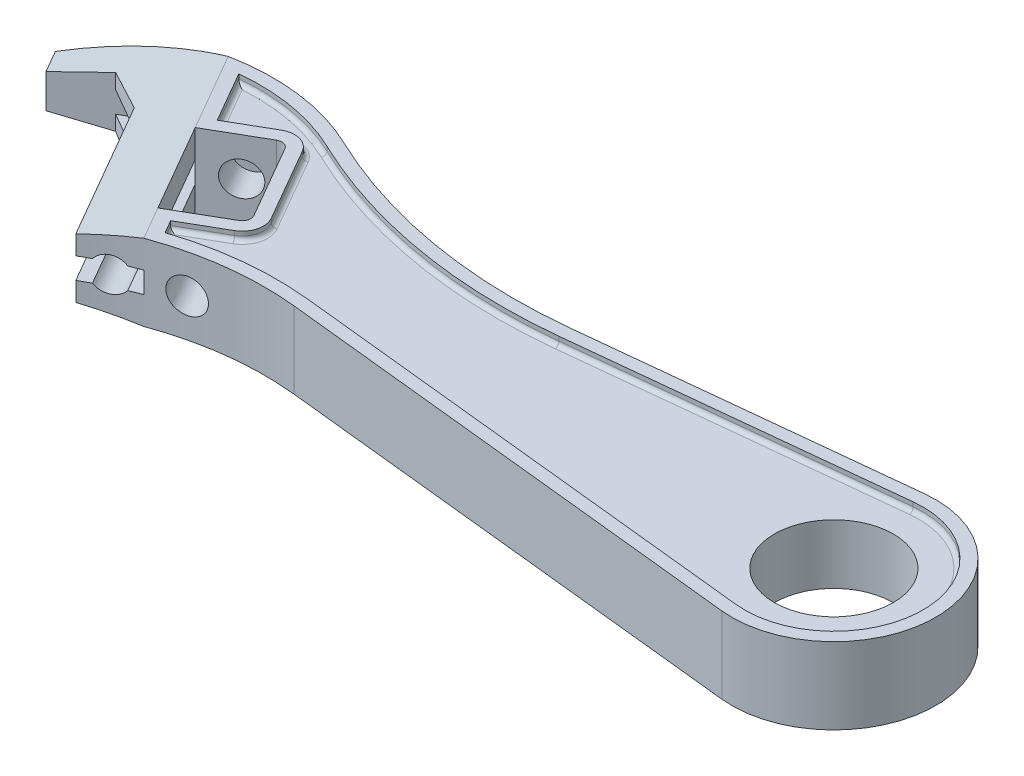
from build123d import *

# Parameters (mm, degrees)
SKETCH2_R               = 7
BOSS_EXTRUDE1_DEPTH     = 4.5
CUT_EXTRUDE1_START      = -8
CUT_EXTRUDE1_DEPTH      = 24.518120701
CUT_EXTRUDE4_DEPTH      = 93.949210641
CUT_EXTRUDE4_DEPTH_BACK = 4
SKETCH3_5_R             = 2
CUT_EXTRUDE2_DEPTH      = 93.949210641
CUT_EXTRUDE2_DEPTH_BACK = 93.949210641
CUT_EXTRUDE3_DEPTH      = 1
FILLET1_R               = 0.5
FILLET1_OF_MIRROR1_R    = 0.5


# Read off the part's stored shape, not the designer's step: Cut-Extrude1
with BuildPart() as part:
    # Sketch2 → Boss-Extrude1 (new, symmetric)
    with BuildSketch(Plane(origin=(0, 0, 0), x_dir=(1, 0, 0), z_dir=(0, 1, 0))):
        with BuildLine():
            Line((-38.985522111, 7.968555867), (-1.254341559, 11.934262744))
            ThreePointArc((-1.254341559, 11.934262744), (12, 0), (-1.254341559, -11.934262744))
            Line((-1.254341559, -11.934262744), (-57.547275152, -6.017637008))
            ThreePointArc((-57.547275152, -6.017637008), (-68.482680545, -6.590737321), (-78.705771366, -10.515014214))
            Line((-78.705771366, -10.515014214), (-88.107695155, 5.769595477))
            Line((-88.107695155, 5.769595477), (-93.303847577, 8.769595477))
            Line((-93.303847577, 8.769595477), (-98.5, 5.769595477))
            Line((-98.5, 5.769595477), (-100, 8.367671688))
            ThreePointArc((-100, 8.367671688), (-86.438642867, 15.605996242), (-71.205780018, 13.541138114))
            ThreePointArc((-71.205780018, 13.541138114), (-55.482588048, 8.517606008), (-38.985522111, 7.968555867))
        make_face()
        with Locations(Location((0, 0, 0), (0, 0, 270))):
            Circle(SKETCH2_R, mode=Mode.SUBTRACT)
        with BuildLine():
            Line((-81.509618943, 6.341392247), (-75.509618943, -4.050912599))
            Line((-75.509618943, -4.050912599), (-69.447441117, -0.550912599))
            ThreePointArc((-69.447441117, -0.550912599), (-68.98151529, 0.05629376), (-69.081415713, 0.815112805))
            Line((-69.081415713, 0.815112805), (-74.081415713, 9.475366843))
            ThreePointArc((-74.081415713, 9.475366843), (-74.688622072, 9.941292669), (-75.447441117, 9.841392247))
            Line((-75.447441117, 9.841392247), (-81.509618943, 6.341392247))
        make_face(mode=Mode.SUBTRACT)
    extrude(amount=BOSS_EXTRUDE1_DEPTH, both=True)

    # Cut-Extrude1 outline → Cut-Extrude1 (cut)
    with BuildSketch(Plane(origin=(-23.123308126, 0, -40.050744514), x_dir=(0.8660254037844396, 0, -0.49999999999999833), z_dir=(0.49999999999999833, 0, 0.8660254037844396)).offset(CUT_EXTRUDE1_START)):
        with BuildLine():
            Line((-82.418704534, 1.25), (-82.418704534, -1.25))
            Line((-82.418704534, -1.25), (-71.979954034, -1.25))
            ThreePointArc((-71.979954034, -1.25), (-70.418704534, -2), (-68.857455035, -1.25))
            Line((-68.857455035, -1.25), (-67.418704534, -1.25))
            Line((-67.418704534, -1.25), (-67.418704534, 1.25))
            Line((-67.418704534, 1.25), (-68.857455035, 1.25))
            ThreePointArc((-68.857455035, 1.25), (-70.418704534, 2), (-71.979954034, 1.25))
            Line((-71.979954034, 1.25), (-82.418704534, 1.25))
        make_face()
    extrude(amount=CUT_EXTRUDE1_DEPTH, mode=Mode.SUBTRACT)

    # Sketch3<5> → Cut-Extrude4 (cut, two sides: drawn at the far end of the back side and taken through both)
    with BuildSketch(Plane(origin=(-23.123308126, 0, -40.050744514), x_dir=(0.8660254037844396, 0, -0.49999999999999833), z_dir=(0.49999999999999833, 0, 0.8660254037844396)).offset(-CUT_EXTRUDE4_DEPTH_BACK)):
        with Locations((-63.418704534, 0)):
            Circle(SKETCH3_5_R)
    extrude(amount=CUT_EXTRUDE4_DEPTH + CUT_EXTRUDE4_DEPTH_BACK, mode=Mode.SUBTRACT)

    # Sketch3<3> → Cut-Extrude2 (cut, two sides: drawn at the far end of the back side and taken through both)
    with BuildSketch(Plane(origin=(-23.123308126, 0, -40.050744514), x_dir=(0.8660254037844396, 0, -0.49999999999999833), z_dir=(0.49999999999999833, 0, 0.8660254037844396)).offset(-CUT_EXTRUDE2_DEPTH_BACK)):
        Polygon((-67.418704534, 4.5), (-82.418704534, 4.5), (-82.418704534, 2), align=None)
        Polygon((-82.418704534, -4.5), (-82.418704534, -2), (-67.418704534, -4.5), align=None)
    extrude(amount=CUT_EXTRUDE2_DEPTH + CUT_EXTRUDE2_DEPTH_BACK, mode=Mode.SUBTRACT)

    # Sketch4 → Cut-Extrude3 (cut)
    with BuildSketch(Plane(origin=(0, 4.5, 0), x_dir=(1, 0, 0), z_dir=(0, 1, 0))):
        with BuildLine():
            Line((-84.417038698, 14.377190981), (-80.960580838, 8.390430352))
            Line((-80.960580838, 8.390430352), (-76.197441117, 11.140430352))
            ThreePointArc((-76.197441117, 11.140430352), (-74.300393504, 11.390181409), (-72.782377607, 10.225366843))
            Line((-72.782377607, 10.225366843), (-67.782377607, 1.565112805))
            ThreePointArc((-67.782377607, 1.565112805), (-67.532626551, -0.331934808), (-68.697441117, -1.849950704))
            Line((-68.697441117, -1.849950704), (-73.460580838, -4.599950704))
            Line((-73.460580838, -4.599950704), (-72.571151937, -6.14048675))
            ThreePointArc((-72.571151937, -6.14048675), (-65.066176866, -4.530624461), (-57.390482457, -4.525854165))
            Line((-57.390482457, -4.525854165), (-1.097548864, -10.442479901))
            ThreePointArc((-1.097548864, -10.442479901), (10.5, 0), (-1.097548864, 10.442479901))
            Line((-1.097548864, 10.442479901), (-38.828729416, 6.476773024))
            ThreePointArc((-38.828729416, 6.476773024), (-55.738222001, 7.039549419), (-71.854493771, 12.188669828))
            ThreePointArc((-71.854493771, 12.188669828), (-77.984484997, 14.151314674), (-84.417038698, 14.377190981))
        make_face()
    cut_extrude3 = extrude(amount=-CUT_EXTRUDE3_DEPTH, mode=Mode.SUBTRACT)

    # Fillet1
    fillet1_edges = [part.edges().sort_by_distance(p)[0] for p in [
        (-77.984484997, 3.5, -14.151314674),
        (-55.738222001, 3.5, -7.039549419),
        (-19.96313914, 3.5, -8.459626463),
        (10.5, 3.5, 0),
        (-29.24401566, 3.5, 7.484167033),
        (-65.066176866, 3.5, 4.530624461),
        (-73.015866387, 3.5, 5.370218727),
        (-71.079010977, 3.5, 3.224950704),
        (-67.532626551, 3.5, 0.331934808),
        (-70.282377607, 3.5, -5.895239824),
        (-74.300393504, 3.5, -11.390181409),
        (-78.579010977, 3.5, -9.765430352),
        (-82.688809768, 3.5, -11.383810667),
    ]]
    fillet(fillet1_edges, radius=FILLET1_R)

    # Mirror1: Cut-Extrude3 across plane
    add(cut_extrude3.mirror(Plane.ZX), mode=Mode.SUBTRACT)

    # Fillet1 of Mirror1
    fillet1_of_mirror1_edges = [part.edges().sort_by_distance(p)[0] for p in [
        (-77.984484997, -3.5, -14.151314674),
        (-55.738222001, -3.5, -7.039549419),
        (-19.96313914, -3.5, -8.459626463),
        (10.5, -3.5, 0),
        (-29.24401566, -3.5, 7.484167033),
        (-65.066176866, -3.5, 4.530624461),
        (-73.015866387, -3.5, 5.370218727),
        (-71.079010977, -3.5, 3.224950704),
        (-67.532626551, -3.5, 0.331934808),
        (-70.282377607, -3.5, -5.895239824),
        (-74.300393504, -3.5, -11.390181409),
        (-78.579010977, -3.5, -9.765430352),
        (-82.688809768, -3.5, -11.383810667),
    ]]
    fillet(fillet1_of_mirror1_edges, radius=FILLET1_OF_MIRROR1_R)


solid = part.part
